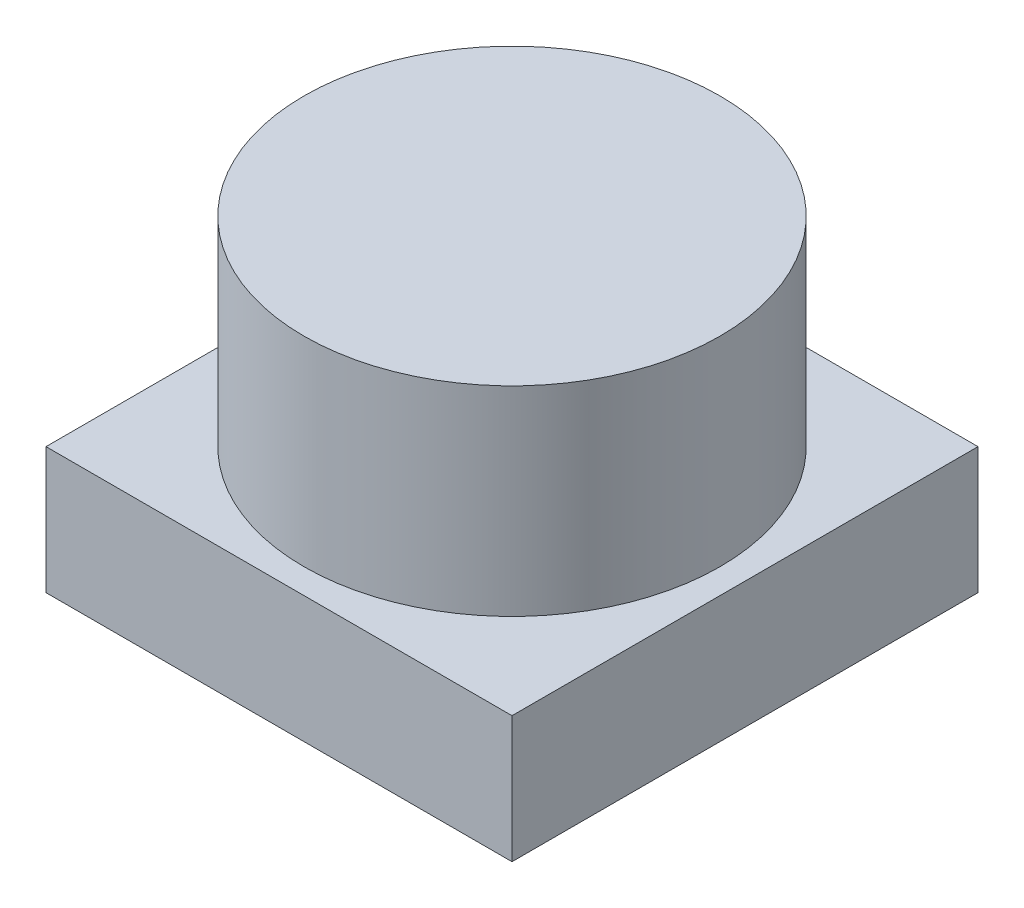
from build123d import *

# Parameters (mm, degrees)
SKETCH1_W           = 7
SKETCH1_H           = 7
BOSS_EXTRUDE1_DEPTH = 1.9
SKETCH2_R           = 3.125
BOSS_EXTRUDE2_DEPTH = 3


with BuildPart() as part:
    # Sketch1 → Boss-Extrude1 (new body)
    with BuildSketch(Plane(origin=(0, 0, 0), x_dir=(1, 0, 0), z_dir=(0, 1, 0))):
        Rectangle(SKETCH1_W, SKETCH1_H)
    extrude(amount=BOSS_EXTRUDE1_DEPTH)

    # Sketch2 → Boss-Extrude2 (add)
    with BuildSketch(Plane(origin=(0, 1.9, 0), x_dir=(1, 0, 0), z_dir=(0, 1, 0))):
        Circle(SKETCH2_R)
    extrude(amount=BOSS_EXTRUDE2_DEPTH)


solid = part.part
